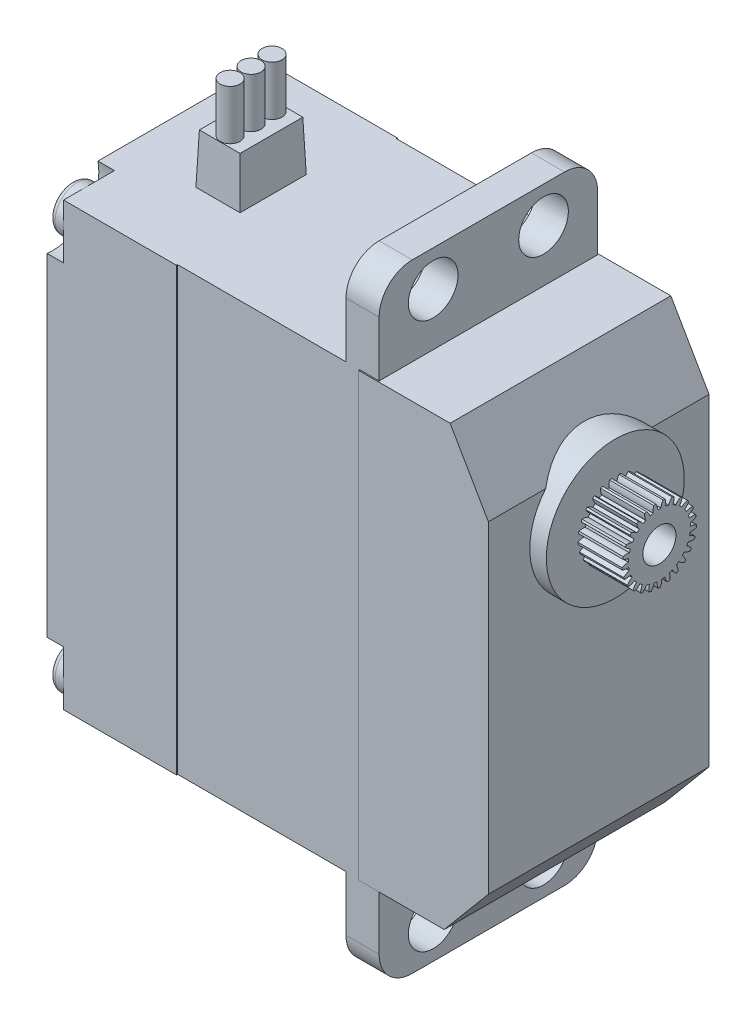
from build123d import *

# Parameters (mm, degrees)
SKETCH_1_W                     = 40
SKETCH_1_H                     = 40
EXTRUDE_1_DEPTH                = 20
SKETCH_2_R                     = 6.25
EXTRUDE_2_DEPTH                = 1.5
SKETCH_10_W                    = 16.5
SKETCH_10_H                    = 40
CUT_EXTRUDE_5_DEPTH            = 0.1
SKETCH_11_W                    = 16.5
SKETCH_11_H                    = 40
CUT_EXTRUDE_6_DEPTH            = 0.1
EXTRUDE_6_DEPTH                = 4
SKETCH_15_R                    = 1.5
CUT_EXTRUDE_9_DEPTH            = 4
CHAMFER_2_SIZE                 = 6
CHAMFER_2_SIZE_2               = 3.464101615
CHAMFER_3_SIZE                 = 4
CHAMFER_3_SIZE2                = 4.76701437
SKETCH_20_W                    = 3
SKETCH_20_H                    = 19.8
EXTRUDE_8_DEPTH                = 8
SKETCH_21_W                    = 3
SKETCH_21_H                    = 19.8
EXTRUDE_9_DEPTH                = 8
FILLET_4_R                     = 3
SKETCH_22_R                    = 2.25
CUT_EXTRUDE_12_DEPTH           = 7.3
CUT_EXTRUDE_13_DEPTH           = 1.5
SKETCH_25_R                    = 2
EXTRUDE_10_DEPTH               = 1.3
FILLET_5_R                     = 0.5
CUT_EXTRUDE_14_DEPTH           = 0.8
CUT_EXTRUDE_14_DRAFT           = -16
CUT_EXTRUDE_14_PROFILE_2_DEPTH = 0.8
CUT_EXTRUDE_14_PROFILE_2_DRAFT = -16
CUT_EXTRUDE_14_PROFILE_3_DEPTH = 0.8
CUT_EXTRUDE_14_PROFILE_3_DRAFT = -16
CUT_EXTRUDE_14_PROFILE_4_DEPTH = 0.8
CUT_EXTRUDE_14_PROFILE_4_DRAFT = -16
EXTRUDE_11_DEPTH               = 4.5
EXTRUDE_11_TAPER               = 2
SKETCH_29_R                    = 0.9
EXTRUDE_12_DEPTH               = 4.5


with BuildPart() as part:
    # 草图1 → 凸台-拉伸1 (new body)
    with BuildSketch(Plane.XY):
        Rectangle(SKETCH_1_W, SKETCH_1_H)
    extrude(amount=EXTRUDE_1_DEPTH)

    # 草图2 → 凸台-拉伸2 (add)
    with BuildSketch(Plane(origin=(20, 0, 0), x_dir=(0, 0, -1), z_dir=(1, 0, 0))):
        with Locations(Location((-10, 10, 0), (0, 0, 180))):
            Circle(SKETCH_2_R)
    extrude(amount=EXTRUDE_2_DEPTH)

    # 草图10 → 切除-拉伸5 (cut)
    with BuildSketch(Plane(origin=(0, 0, 0), x_dir=(-1, 0, 0), z_dir=(0, 0, -1))):
        Rectangle(SKETCH_10_W, SKETCH_10_H)
    extrude(amount=-CUT_EXTRUDE_5_DEPTH, mode=Mode.SUBTRACT)

    # 草图11 → 切除-拉伸6 (cut)
    with BuildSketch(Plane.XY.offset(20)):
        Rectangle(SKETCH_11_W, SKETCH_11_H)
    extrude(amount=-CUT_EXTRUDE_6_DEPTH, mode=Mode.SUBTRACT)

    # 草图14 → 凸台-拉伸6 (add)
    with BuildSketch(Plane(origin=(21.5, 0, 0), x_dir=(0, 0, -1), z_dir=(1, 0, 0))):
        with BuildLine():
            ThreePointArc((-8.846239781, 13.115962333), (-9.03476861, 12.891446635), (-9.16581789, 12.629193887))
            ThreePointArc((-9.16581789, 12.629193887), (-9.300808382, 12.667468341), (-9.437540311, 12.698960347))
            ThreePointArc((-9.437540311, 12.698960347), (-9.426038446, 12.991907654), (-9.483086256, 13.279476716))
            ThreePointArc((-9.483086256, 13.279476716), (-9.577000337, 13.2926839), (-9.671248428, 13.303247126))
            ThreePointArc((-9.671248428, 13.303247126), (-9.798019493, 13.038899789), (-9.859732013, 12.752295562))
            ThreePointArc((-9.859732013, 12.752295562), (-10, 12.755796783), (-10.140267987, 12.752295562))
            ThreePointArc((-10.140267987, 12.752295562), (-10.201980507, 13.038899789), (-10.328751572, 13.303247126))
            ThreePointArc((-10.328751572, 13.303247126), (-10.422999663, 13.2926839), (-10.516913744, 13.279476716))
            ThreePointArc((-10.516913744, 13.279476716), (-10.573961554, 12.991907654), (-10.562459689, 12.698960347))
            ThreePointArc((-10.562459689, 12.698960347), (-10.699191618, 12.667468341), (-10.83418211, 12.629193887))
            ThreePointArc((-10.83418211, 12.629193887), (-10.96523139, 12.891446635), (-11.153760219, 13.115962333))
            ThreePointArc((-11.153760219, 13.115962333), (-11.242420365, 13.082292423), (-11.33009947, 13.046144684))
            ThreePointArc((-11.33009947, 13.046144684), (-11.3138395, 12.75342292), (-11.229845954, 12.472539489))
            ThreePointArc((-11.229845954, 12.472539489), (-11.354450455, 12.408033014), (-11.475681503, 12.337390252))
            ThreePointArc((-11.475681503, 12.337390252), (-11.667833235, 12.558813218), (-11.906273868, 12.729390129))
            ThreePointArc((-11.906273868, 12.729390129), (-11.983775226, 12.674729139), (-12.059710153, 12.617912142))
            ThreePointArc((-12.059710153, 12.617912142), (-11.971164078, 12.33843046), (-11.819956475, 12.087259844))
            ThreePointArc((-11.819956475, 12.087259844), (-11.924604188, 11.993792079), (-12.0244584, 11.895219754))
            ThreePointArc((-12.0244584, 11.895219754), (-12.265638984, 12.061900117), (-12.539009318, 12.167820267))
            ThreePointArc((-12.539009318, 12.167820267), (-12.600482194, 12.095602749), (-12.659901673, 12.021686513))
            ThreePointArc((-12.659901673, 12.021686513), (-12.504633168, 11.773005776), (-12.295712438, 11.567329948))
            ThreePointArc((-12.295712438, 11.567329948), (-12.373827963, 11.450773817), (-12.44603113, 11.33046559))
            ThreePointArc((-12.44603113, 11.33046559), (-12.721086303, 11.431930211), (-13.012209476, 11.466538247))
            ThreePointArc((-13.012209476, 11.466538247), (-13.053791302, 11.381301892), (-13.092961788, 11.294930848))
            ThreePointArc((-13.092961788, 11.294930848), (-12.880726944, 11.09267658), (-12.627220344, 10.94541891))
            ThreePointArc((-12.627220344, 10.94541891), (-12.673895396, 10.813098063), (-12.713910728, 10.678613343))
            ThreePointArc((-12.713910728, 10.678613343), (-13.005557763, 10.708486826), (-13.296141434, 10.669608197))
            ThreePointArc((-13.296141434, 10.669608197), (-13.315219471, 10.57670872), (-13.331679739, 10.483309877))
            ThreePointArc((-13.331679739, 10.483309877), (-13.075814052, 10.340190458), (-12.793650335, 10.260603686))
            ThreePointArc((-12.793650335, 10.260603686), (-12.805952147, 10.120832329), (-12.811265334, 9.980621285))
            ThreePointArc((-12.811265334, 9.980621285), (-13.101178974, 9.937026569), (-13.372964703, 9.827104164))
            ThreePointArc((-13.372964703, 9.827104164), (-13.368340208, 9.73237878), (-13.361055999, 9.637820731))
            ThreePointArc((-13.361055999, 9.637820731), (-13.077636451, 9.562828881), (-12.784545, 9.555913737))
            ThreePointArc((-12.784545, 9.555913737), (-12.761700605, 9.417474217), (-12.731977801, 9.280346825))
            ThreePointArc((-12.731977801, 9.280346825), (-13.001941705, 9.166023127), (-13.237852195, 8.991963774))
            ThreePointArc((-13.237852195, 8.991963774), (-13.209815742, 8.901364427), (-13.179244749, 8.811588602))
            ThreePointArc((-13.179244749, 8.811588602), (-12.886079633, 8.809436335), (-12.600476463, 8.875627322))
            ThreePointArc((-12.600476463, 8.875627322), (-12.543921258, 8.747218305), (-12.481030054, 8.621790783))
            ThreePointArc((-12.481030054, 8.621790783), (-12.714081399, 8.443921481), (-12.899293526, 8.21666197))
            ThreePointArc((-12.899293526, 8.21666197), (-12.849606749, 8.13588135), (-12.79766986, 8.056528695))
            ThreePointArc((-12.79766986, 8.056528695), (-12.513179817, 8.127351244), (-12.253010425, 8.26248934))
            ThreePointArc((-12.253010425, 8.26248934), (-12.166297982, 8.152179236), (-12.074190065, 8.046332657))
            ThreePointArc((-12.074190065, 8.046332657), (-12.255685376, 7.816093934), (-12.378561582, 7.549913815))
            ThreePointArc((-12.378561582, 7.549913815), (-12.310346483, 7.484027666), (-12.240307084, 7.420084199))
            ThreePointArc((-12.240307084, 7.420084199), (-11.982367671, 7.559431524), (-11.763979456, 7.755025506))
            ThreePointArc((-11.763979456, 7.755025506), (-11.652558237, 7.669745504), (-11.537021085, 7.590130597))
            ThreePointArc((-11.537021085, 7.590130597), (-11.655556346, 7.321989198), (-11.708375865, 7.033613547))
            ThreePointArc((-11.708375865, 7.033613547), (-11.62591865, 6.986761738), (-11.542177574, 6.942245263))
            ThreePointArc((-11.542177574, 6.942245263), (-11.326996073, 7.14136166), (-11.164111171, 7.385121637))
            ThreePointArc((-11.164111171, 7.385121637), (-11.03498218, 7.330230193), (-10.903275418, 7.281849456))
            ThreePointArc((-10.903275418, 7.281849456), (-10.951402621, 6.992653692), (-10.930846611, 6.700202212))
            ThreePointArc((-10.930846611, 6.700202212), (-10.839328369, 6.675328615), (-10.747147376, 6.653036265))
            ThreePointArc((-10.747147376, 6.653036265), (-10.588244432, 6.899410517), (-10.491097499, 7.176020154))
            ThreePointArc((-10.491097499, 7.176020154), (-10.352374386, 7.154966301), (-10.212773634, 7.140859673))
            ThreePointArc((-10.212773634, 7.140859673), (-10.187468771, 6.848780777), (-10.09482884, 6.57062927))
            ThreePointArc((-10.09482884, 6.57062927), (-10, 6.569296783), (-9.90517116, 6.57062927))
            ThreePointArc((-9.90517116, 6.57062927), (-9.812531229, 6.848780777), (-9.787226366, 7.140859673))
            ThreePointArc((-9.787226366, 7.140859673), (-9.647625614, 7.154966301), (-9.508902501, 7.176020154))
            ThreePointArc((-9.508902501, 7.176020154), (-9.411755568, 6.899410517), (-9.252852624, 6.653036265))
            ThreePointArc((-9.252852624, 6.653036265), (-9.160671631, 6.675328615), (-9.069153389, 6.700202212))
            ThreePointArc((-9.069153389, 6.700202212), (-9.048597379, 6.992653692), (-9.096724582, 7.281849456))
            ThreePointArc((-9.096724582, 7.281849456), (-8.96501782, 7.330230193), (-8.835888829, 7.385121637))
            ThreePointArc((-8.835888829, 7.385121637), (-8.673003927, 7.14136166), (-8.457822426, 6.942245263))
            ThreePointArc((-8.457822426, 6.942245263), (-8.37408135, 6.986761738), (-8.291624135, 7.033613547))
            ThreePointArc((-8.291624135, 7.033613547), (-8.344443654, 7.321989198), (-8.462978915, 7.590130597))
            ThreePointArc((-8.462978915, 7.590130597), (-8.347441763, 7.669745504), (-8.236020544, 7.755025506))
            ThreePointArc((-8.236020544, 7.755025506), (-8.017632329, 7.559431524), (-7.759692916, 7.420084199))
            ThreePointArc((-7.759692916, 7.420084199), (-7.689653517, 7.484027666), (-7.621438418, 7.549913815))
            ThreePointArc((-7.621438418, 7.549913815), (-7.744314624, 7.816093934), (-7.925809935, 8.046332657))
            ThreePointArc((-7.925809935, 8.046332657), (-7.833702018, 8.152179236), (-7.746989575, 8.26248934))
            ThreePointArc((-7.746989575, 8.26248934), (-7.486820183, 8.127351244), (-7.20233014, 8.056528695))
            ThreePointArc((-7.20233014, 8.056528695), (-7.150393251, 8.13588135), (-7.100706474, 8.21666197))
            ThreePointArc((-7.100706474, 8.21666197), (-7.285918601, 8.443921481), (-7.518969946, 8.621790783))
            ThreePointArc((-7.518969946, 8.621790783), (-7.456078742, 8.747218305), (-7.399523537, 8.875627322))
            ThreePointArc((-7.399523537, 8.875627322), (-7.113920367, 8.809436335), (-6.820755251, 8.811588602))
            ThreePointArc((-6.820755251, 8.811588602), (-6.790184258, 8.901364427), (-6.762147805, 8.991963774))
            ThreePointArc((-6.762147805, 8.991963774), (-6.998058295, 9.166023127), (-7.268022199, 9.280346825))
            ThreePointArc((-7.268022199, 9.280346825), (-7.238299395, 9.417474217), (-7.215455, 9.555913737))
            ThreePointArc((-7.215455, 9.555913737), (-6.922363549, 9.562828881), (-6.638944001, 9.637820731))
            ThreePointArc((-6.638944001, 9.637820731), (-6.631659792, 9.73237878), (-6.627035297, 9.827104164))
            ThreePointArc((-6.627035297, 9.827104164), (-6.898821026, 9.937026569), (-7.188734666, 9.980621285))
            ThreePointArc((-7.188734666, 9.980621285), (-7.194047853, 10.120832329), (-7.206349665, 10.260603686))
            ThreePointArc((-7.206349665, 10.260603686), (-6.924185948, 10.340190458), (-6.668320261, 10.483309877))
            ThreePointArc((-6.668320261, 10.483309877), (-6.684780529, 10.57670872), (-6.703858566, 10.669608197))
            ThreePointArc((-6.703858566, 10.669608197), (-6.994442237, 10.708486826), (-7.286089272, 10.678613343))
            ThreePointArc((-7.286089272, 10.678613343), (-7.326104604, 10.813098063), (-7.372779656, 10.94541891))
            ThreePointArc((-7.372779656, 10.94541891), (-7.119273056, 11.09267658), (-6.907038212, 11.294930848))
            ThreePointArc((-6.907038212, 11.294930848), (-6.946208698, 11.381301892), (-6.987790524, 11.466538247))
            ThreePointArc((-6.987790524, 11.466538247), (-7.278913697, 11.431930211), (-7.55396887, 11.33046559))
            ThreePointArc((-7.55396887, 11.33046559), (-7.626172037, 11.450773817), (-7.704287562, 11.567329948))
            ThreePointArc((-7.704287562, 11.567329948), (-7.495366832, 11.773005776), (-7.340098327, 12.021686513))
            ThreePointArc((-7.340098327, 12.021686513), (-7.399517806, 12.095602749), (-7.460990682, 12.167820267))
            ThreePointArc((-7.460990682, 12.167820267), (-7.734361016, 12.061900117), (-7.9755416, 11.895219754))
            ThreePointArc((-7.9755416, 11.895219754), (-8.075395812, 11.993792079), (-8.180043525, 12.087259844))
            ThreePointArc((-8.180043525, 12.087259844), (-8.028835922, 12.33843046), (-7.940289847, 12.617912142))
            ThreePointArc((-7.940289847, 12.617912142), (-8.016224774, 12.674729139), (-8.093726132, 12.729390129))
            ThreePointArc((-8.093726132, 12.729390129), (-8.332166765, 12.558813218), (-8.524318497, 12.337390252))
            ThreePointArc((-8.524318497, 12.337390252), (-8.645549545, 12.408033014), (-8.770154046, 12.472539489))
            ThreePointArc((-8.770154046, 12.472539489), (-8.6861605, 12.75342292), (-8.66990053, 13.046144684))
            ThreePointArc((-8.66990053, 13.046144684), (-8.757579635, 13.082292423), (-8.846239781, 13.115962333))
        make_face()
    extrude(amount=EXTRUDE_6_DEPTH)

    # 草图15 → 切除-拉伸9 (cut)
    with BuildSketch(Plane(origin=(25.5, 0, 0), x_dir=(0, 0, -1), z_dir=(1, 0, 0))):
        with Locations((-10, 9.944296783)):
            Circle(SKETCH_15_R)
    extrude(amount=-CUT_EXTRUDE_9_DEPTH, mode=Mode.SUBTRACT)

    # 倒角2
    # the kernel refuses this chamfer: 6, 3.464101615 mm, written as the material it takes off along each edge
    with BuildSketch(Plane(origin=(20, 20, -15.522514528), x_dir=(0.019326765612700865, -0.9998132206222078, 0), z_dir=(0, 0, 1))) as chamfer_2_piece_1_section:
        Polygon((CHAMFER_2_SIZE * 0.999813220622, -CHAMFER_2_SIZE * 0.0193267656127), (-CHAMFER_2_SIZE_2 * 0.0193267656135, -CHAMFER_2_SIZE_2 * 0.999813220662), (0, 0), align=None)
    chamfer_2_piece_1 = extrude(amount=51.045029056, mode=Mode.PRIVATE)
    chamfer_2_piece_1 = chamfer_2_piece_1 - Plane(origin=(18.872868859, 10, 10), x_dir=(0, 0, 1), z_dir=(-1, 0, 0)) * Cylinder(6.25, 127, mode=Mode.PRIVATE)
    add(chamfer_2_piece_1, mode=Mode.SUBTRACT)

    # 倒角3
    chamfer_3_edges = [part.edges().sort_by_distance(p)[0] for p in [
        (20, -20, 10),
    ]]
    chamfer_3_side = [part.faces().sort_by_distance(p)[0] for p in [
        (0, -20, 10),
    ]]
    chamfer(chamfer_3_edges, length=CHAMFER_3_SIZE, length2=CHAMFER_3_SIZE2, reference=chamfer_3_side[0])

    # 草图20 → 凸台-拉伸8 (add)
    with BuildSketch(Plane(origin=(0, -20, 0), x_dir=(-1, 0, 0), z_dir=(0, -1, 0))):
        with Locations((-8.5, -10)):
            Rectangle(SKETCH_20_W, SKETCH_20_H)
    extrude(amount=EXTRUDE_8_DEPTH)

    # 草图21 → 凸台-拉伸9 (add)
    with BuildSketch(Plane(origin=(0, 20, 0), x_dir=(1, 0, 0), z_dir=(0, 1, 0))):
        with Locations((8.5, -10)):
            Rectangle(SKETCH_21_W, SKETCH_21_H)
    extrude(amount=EXTRUDE_9_DEPTH)

    # 圆角4
    fillet_4_edges = [part.edges().sort_by_distance(p)[0] for p in [
        (8.5, 28, 19.9),
        (8.5, 28, 0.1),
        (8.5, -28, 19.9),
        (8.5, -28, 0.1),
    ]]
    fillet(fillet_4_edges, radius=FILLET_4_R)

    # 草图22 → 切除-拉伸12 (cut)
    with BuildSketch(Plane(origin=(10, 0, 0), x_dir=(0, 0, -1), z_dir=(1, 0, 0))):
        with Locations((-15, 24.75)):
            Circle(SKETCH_22_R)
        with Locations((-5, 24.75)):
            Circle(SKETCH_22_R)
        with Locations((-5, -24.75)):
            Circle(SKETCH_22_R)
        with Locations((-15, -24.75)):
            Circle(SKETCH_22_R)
    extrude(amount=-CUT_EXTRUDE_12_DEPTH, mode=Mode.SUBTRACT)

    # 草图24 → 切除-拉伸13 (cut)
    with BuildSketch(Plane.ZY.offset(20)):
        with BuildLine():
            Line((0, 15.059831138), (0, 20))
            Line((0, 20), (4.619724316, 20))
            ThreePointArc((4.619724316, 20), (3.582907294, 16.339446633), (0, 15.059831138))
        make_face()
        with BuildLine():
            Line((20, 15.059831138), (20, 20))
            Line((20, 20), (15.380275684, 20))
            ThreePointArc((15.380275684, 20), (16.417092706, 16.339446633), (20, 15.059831138))
        make_face()
        with BuildLine():
            Line((0, -20), (4.619724316, -20))
            ThreePointArc((4.619724316, -20), (3.582907294, -16.339446633), (0, -15.059831138))
            Line((0, -15.059831138), (0, -20))
        make_face()
        with BuildLine():
            Line((20, -20), (15.380275684, -20))
            ThreePointArc((15.380275684, -20), (16.417092706, -16.339446633), (20, -15.059831138))
            Line((20, -15.059831138), (20, -20))
        make_face()
    extrude(amount=-CUT_EXTRUDE_13_DEPTH, mode=Mode.SUBTRACT)

    # 草图25 → 凸台-拉伸10 (add)
    with BuildSketch(Plane.ZY.offset(18.5)):
        with Locations(Location((2.039859112, 17.947190939, 0), (0, 0, 180))):
            Circle(SKETCH_25_R)
        with Locations(Location((17.960140888, 17.947190939, 0), (0, 0, 180))):
            Circle(SKETCH_25_R)
        with Locations(Location((2.039859112, -17.947190939, 0), (0, 0, 180))):
            Circle(SKETCH_25_R)
        with Locations(Location((17.960140888, -17.947190939, 0), (0, 0, 180))):
            Circle(SKETCH_25_R)
    extrude(amount=EXTRUDE_10_DEPTH)

    # 圆角5
    fillet_5_edges = [part.edges().sort_by_distance(p)[0] for p in [
        (-19.8, 17.947190939, 4.039859112),
        (-19.8, 17.947190939, 19.960140888),
        (-19.8, -17.947190939, 4.039859112),
        (-19.8, -17.947190939, 19.960140888),
    ]]
    fillet(fillet_5_edges, radius=FILLET_5_R)


with BuildPart() as cut_extrude_14_tool:
    # 草图26 → 切除-拉伸14 (with draft: the straight prism first)
    with BuildSketch(Plane.ZY.offset(19.8)):
        Polygon((1.639859112, 18.347190939), (0.594175883, 18.347190939), (0.594175883, 17.547190939), (1.639859112, 17.547190939), (1.639859112, 16.501507709), (2.439859112, 16.501507709), (2.439859112, 17.547190939), (3.485542342, 17.547190939), (3.485542342, 18.347190939), (2.439859112, 18.347190939), (2.439859112, 19.392874168), (1.639859112, 19.392874168), align=None)
    extrude(amount=-CUT_EXTRUDE_14_DEPTH)
    # 切除-拉伸14: the draft: its side faces are tilted about the plane it starts from
    cut_extrude_14_sides = [cut_extrude_14_tool.faces().sort_by_distance(p)[0] for p in [
        (-19.4, 18.347190939, 1.117017497),
        (-19.4, 17.947190939, 0.594175883),
        (-19.4, 17.547190939, 1.117017497),
        (-19.4, 17.024349324, 1.639859112),
        (-19.4, 16.501507709, 2.039859112),
        (-19.4, 17.024349324, 2.439859112),
        (-19.4, 17.547190939, 2.962700727),
        (-19.4, 17.947190939, 3.485542342),
        (-19.4, 18.347190939, 2.962700727),
        (-19.4, 18.870032553, 2.439859112),
        (-19.4, 19.392874168, 2.039859112),
        (-19.4, 18.870032553, 1.639859112),
    ]]
    draft(cut_extrude_14_sides, Plane.ZY.offset(19.8), CUT_EXTRUDE_14_DRAFT)


with BuildPart() as part_1:
    add(part.part)

    # 切除-拉伸14: cut by cut_extrude_14_tool
    add(cut_extrude_14_tool.part, mode=Mode.SUBTRACT)


with BuildPart() as cut_extrude_14_profile_2_tool:
    # 草图26 → 切除-拉伸14 profile 2 (with draft: the straight prism first)
    with BuildSketch(Plane.ZY.offset(19.8)):
        Polygon((18.387715981, 18.347190939), (18.387715981, 19.392874168), (17.587715981, 19.392874168), (17.587715981, 18.347190939), (16.542032752, 18.347190939), (16.542032752, 17.547190939), (17.587715981, 17.547190939), (17.587715981, 16.501507709), (18.387715981, 16.501507709), (18.387715981, 17.547190939), (19.433399211, 17.547190939), (19.433399211, 18.347190939), align=None)
    extrude(amount=-CUT_EXTRUDE_14_PROFILE_2_DEPTH)
    # 切除-拉伸14 profile 2: the draft: its side faces are tilted about the plane it starts from
    cut_extrude_14_profile_2_sides = [cut_extrude_14_profile_2_tool.faces().sort_by_distance(p)[0] for p in [
        (-19.4, 18.870032553, 18.387715981),
        (-19.4, 19.392874168, 17.987715981),
        (-19.4, 18.870032553, 17.587715981),
        (-19.4, 18.347190939, 17.064874366),
        (-19.4, 17.947190939, 16.542032752),
        (-19.4, 17.547190939, 17.064874366),
        (-19.4, 17.024349324, 17.587715981),
        (-19.4, 16.501507709, 17.987715981),
        (-19.4, 17.024349324, 18.387715981),
        (-19.4, 17.547190939, 18.910557596),
        (-19.4, 17.947190939, 19.433399211),
        (-19.4, 18.347190939, 18.910557596),
    ]]
    draft(cut_extrude_14_profile_2_sides, Plane.ZY.offset(19.8), CUT_EXTRUDE_14_PROFILE_2_DRAFT)


with BuildPart() as part_2:
    add(part_1.part)

    # 切除-拉伸14 profile 2: cut by cut_extrude_14_profile_2_tool
    add(cut_extrude_14_profile_2_tool.part, mode=Mode.SUBTRACT)


with BuildPart() as cut_extrude_14_profile_3_tool:
    # 草图26 → 切除-拉伸14 profile 3 (with draft: the straight prism first)
    with BuildSketch(Plane.ZY.offset(19.8)):
        Polygon((18.387715981, -18.347190939), (19.433399211, -18.347190939), (19.433399211, -17.547190939), (18.387715981, -17.547190939), (18.387715981, -16.501507709), (17.587715981, -16.501507709), (17.587715981, -17.547190939), (16.542032752, -17.547190939), (16.542032752, -18.347190939), (17.587715981, -18.347190939), (17.587715981, -19.392874168), (18.387715981, -19.392874168), align=None)
    extrude(amount=-CUT_EXTRUDE_14_PROFILE_3_DEPTH)
    # 切除-拉伸14 profile 3: the draft: its side faces are tilted about the plane it starts from
    cut_extrude_14_profile_3_sides = [cut_extrude_14_profile_3_tool.faces().sort_by_distance(p)[0] for p in [
        (-19.4, -18.347190939, 18.910557596),
        (-19.4, -17.947190939, 19.433399211),
        (-19.4, -17.547190939, 18.910557596),
        (-19.4, -17.024349324, 18.387715981),
        (-19.4, -16.501507709, 17.987715981),
        (-19.4, -17.024349324, 17.587715981),
        (-19.4, -17.547190939, 17.064874366),
        (-19.4, -17.947190939, 16.542032752),
        (-19.4, -18.347190939, 17.064874366),
        (-19.4, -18.870032553, 17.587715981),
        (-19.4, -19.392874168, 17.987715981),
        (-19.4, -18.870032553, 18.387715981),
    ]]
    draft(cut_extrude_14_profile_3_sides, Plane.ZY.offset(19.8), CUT_EXTRUDE_14_PROFILE_3_DRAFT)


with BuildPart() as part_3:
    add(part_2.part)

    # 切除-拉伸14 profile 3: cut by cut_extrude_14_profile_3_tool
    add(cut_extrude_14_profile_3_tool.part, mode=Mode.SUBTRACT)


with BuildPart() as cut_extrude_14_profile_4_tool:
    # 草图26 → 切除-拉伸14 profile 4 (with draft: the straight prism first)
    with BuildSketch(Plane.ZY.offset(19.8)):
        Polygon((1.639859112, -18.347190939), (1.639859112, -19.392874168), (2.439859112, -19.392874168), (2.439859112, -18.347190939), (3.485542342, -18.347190939), (3.485542342, -17.547190939), (2.439859112, -17.547190939), (2.439859112, -16.501507709), (1.639859112, -16.501507709), (1.639859112, -17.547190939), (0.594175883, -17.547190939), (0.594175883, -18.347190939), align=None)
    extrude(amount=-CUT_EXTRUDE_14_PROFILE_4_DEPTH)
    # 切除-拉伸14 profile 4: the draft: its side faces are tilted about the plane it starts from
    cut_extrude_14_profile_4_sides = [cut_extrude_14_profile_4_tool.faces().sort_by_distance(p)[0] for p in [
        (-19.4, -18.870032553, 1.639859112),
        (-19.4, -19.392874168, 2.039859112),
        (-19.4, -18.870032553, 2.439859112),
        (-19.4, -18.347190939, 2.962700727),
        (-19.4, -17.947190939, 3.485542342),
        (-19.4, -17.547190939, 2.962700727),
        (-19.4, -17.024349324, 2.439859112),
        (-19.4, -16.501507709, 2.039859112),
        (-19.4, -17.024349324, 1.639859112),
        (-19.4, -17.547190939, 1.117017497),
        (-19.4, -17.947190939, 0.594175883),
        (-19.4, -18.347190939, 1.117017497),
    ]]
    draft(cut_extrude_14_profile_4_sides, Plane.ZY.offset(19.8), CUT_EXTRUDE_14_PROFILE_4_DRAFT)


with BuildPart() as part_4:
    add(part_3.part)

    # 切除-拉伸14 profile 4: cut by cut_extrude_14_profile_4_tool
    add(cut_extrude_14_profile_4_tool.part, mode=Mode.SUBTRACT)

    # 草图28 → 凸台-拉伸11 (add)
    with BuildSketch(Plane(origin=(0, 20, 0), x_dir=(1, 0, 0), z_dir=(0, 1, 0))):
        Polygon((-9.5, -10), (-9.5, -7), (-13.5, -7), (-13.5, -13), (-9.5, -13), align=None)
    extrude(amount=EXTRUDE_11_DEPTH, taper=EXTRUDE_11_TAPER)

    # 草图29 → 凸台-拉伸12 (add)
    with BuildSketch(Plane(origin=(0, 24.5, 0), x_dir=(1, 0, 0), z_dir=(0, 1, 0))):
        with Locations(Location((-11.5, -11.9, 0), (0, 0, 270))):
            Circle(SKETCH_29_R)
        with Locations(Location((-11.5, -8.1, 0), (0, 0, 270))):
            Circle(SKETCH_29_R)
        with Locations(Location((-11.5, -10.002513208, 0), (0, 0, 270))):
            Circle(SKETCH_29_R)
    extrude(amount=EXTRUDE_12_DEPTH)


solid = part_4.part
